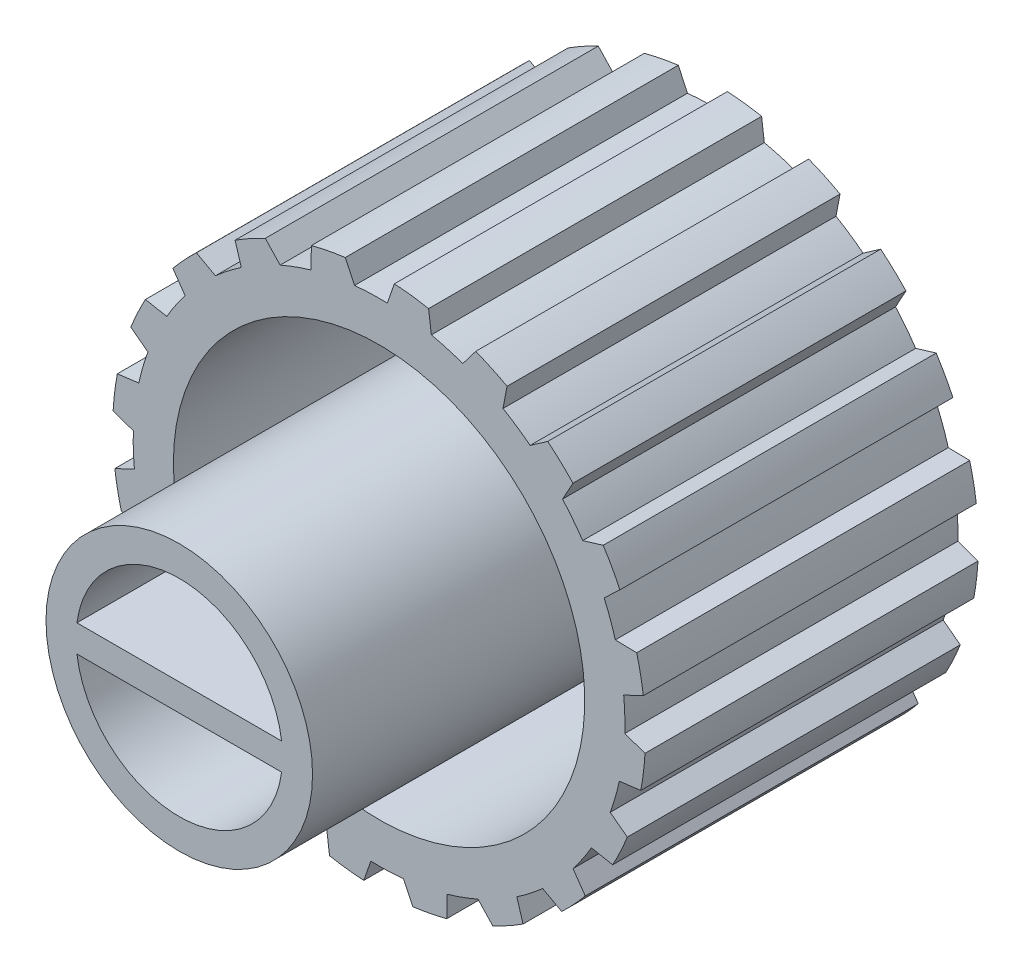
from build123d import *

# Parameters (mm, degrees)
CROQUIS1_R                    = 8
SALIENTE_EXTRUIR1_DEPTH       = 10
CROQUIS2_R                    = 7
CORTAR_EXTRUIR1_DEPTH         = 8
CROQUIS3_R                    = 5
SALIENTE_EXTRUIR2_DEPTH       = 14
CROQUIS4_R                    = 3.5
CORTAR_EXTRUIR2_DEPTH         = 14
CROQUIS5_W                    = 8.830556774
CROQUIS5_H                    = 0.810001326
SALIENTE_EXTRUIR3_DEPTH       = 14
SALIENTE_EXTRUIR4_START       = -10
SALIENTE_EXTRUIR4_OUTLINE_R   = 7
SALIENTE_EXTRUIR4_OUTLINE_R_2 = 6.177042676
SALIENTE_EXTRUIR4_DEPTH       = 8
CORTAR_EXTRUIR10_DEPTH        = 10
SALIENTE_EXTRUIR7_START       = -14
CROQUIS12_R                   = 3.5
CROQUIS12_R_2                 = 3.1
SALIENTE_EXTRUIR7_DEPTH       = 14
CROQUIS14_R                   = 5.293122991
CROQUIS14_R_2                 = 4.002052416
CORTAR_EXTRUIR15_DEPTH        = 14


# Read off the part's stored shape, not the designer's step: Saliente-Extruir4
with BuildPart() as part:
    # Croquis1 → Saliente-Extruir1 (new body)
    with BuildSketch(Plane.XY):
        Circle(CROQUIS1_R)
    extrude(amount=SALIENTE_EXTRUIR1_DEPTH)

    # Croquis2 → Cortar-Extruir1 (cut)
    with BuildSketch(Plane.XY.offset(10)):
        Circle(CROQUIS2_R)
    extrude(amount=-CORTAR_EXTRUIR1_DEPTH, mode=Mode.SUBTRACT)

    # Croquis3 → Saliente-Extruir2 (add)
    with BuildSketch(Plane.XY.offset(2)):
        Circle(CROQUIS3_R)
    extrude(amount=SALIENTE_EXTRUIR2_DEPTH)

    # Croquis4 → Cortar-Extruir2 (cut)
    with BuildSketch(Plane.XY.offset(16)):
        Circle(CROQUIS4_R)
    extrude(amount=-CORTAR_EXTRUIR2_DEPTH, mode=Mode.SUBTRACT)

    # Croquis5 → Saliente-Extruir3 (add)
    with BuildSketch(Plane.XY.offset(2)):
        Rectangle(CROQUIS5_W, CROQUIS5_H)
    extrude(amount=SALIENTE_EXTRUIR3_DEPTH)

    # Saliente-Extruir4 outline → Saliente-Extruir4 (add)
    with BuildSketch(Plane(origin=(0, 0, 0), x_dir=(-1, 0, 0), z_dir=(0, 0, -1)).offset(SALIENTE_EXTRUIR4_START)):
        Circle(SALIENTE_EXTRUIR4_OUTLINE_R)
        Circle(SALIENTE_EXTRUIR4_OUTLINE_R_2, mode=Mode.SUBTRACT)
    extrude(amount=SALIENTE_EXTRUIR4_DEPTH)

    # Croquis11 → Cortar-Extruir10 (cut)
    with BuildSketch(Plane(origin=(0, 0, 0), x_dir=(-1, 0, 0), z_dir=(0, 0, -1))):
        with BuildLine():
            Line((-0.247260298, 7.379594776), (-0.5002941, 8.108053777))
            Line((-0.5002941, 8.108053777), (1.061510951, 8.036738478))
            Line((1.061510951, 8.036738478), (0.736778233, 7.346884683))
            ThreePointArc((0.736778233, 7.346884683), (0.245304789, 7.379660038), (-0.247260298, 7.379594776))
        make_face()
        with BuildLine():
            Line((2.029718445, 7.865816758), (3.493045676, 7.315367575))
            Line((3.493045676, 7.315367575), (2.971029962, 6.759625557))
            ThreePointArc((2.971029962, 6.759625557), (2.513739083, 6.942670418), (2.045261679, 7.094819334))
            Line((2.045261679, 7.094819334), (2.029718445, 7.865816758))
        make_face()
        with BuildLine():
            Line((4.137579194, 6.115553542), (4.361048006, 6.853618791))
            Line((4.361048006, 6.853618791), (5.582656753, 5.877917526))
            Line((5.582656753, 5.877917526), (4.914456579, 5.510687185))
            ThreePointArc((4.914456579, 5.510687185), (4.536111081, 5.826083846), (4.137579194, 6.115553542))
        make_face()
        with BuildLine():
            Line((5.824881629, 4.537654761), (6.265487803, 5.170540864))
            Line((6.265487803, 5.170540864), (7.12579849, 3.865095955))
            Line((7.12579849, 3.865095955), (6.376821944, 3.722324356))
            ThreePointArc((6.376821944, 3.722324356), (6.114456921, 4.139199594), (5.824881629, 4.537654761))
        make_face()
        with BuildLine():
            Line((6.942004065, 2.515578715), (7.556618, 2.981334372))
            Line((7.556618, 2.981334372), (7.971417423, 1.473931862))
            Line((7.971417423, 1.473931862), (7.214979548, 1.569594483))
            ThreePointArc((7.214979548, 1.569594483), (7.094277116, 2.047141646), (6.942004065, 2.515578715))
        make_face()
        with BuildLine():
            Line((7.379594776, 0.247260298), (8.108053777, 0.5002941))
            Line((8.108053777, 0.5002941), (8.036738478, -1.061510951))
            Line((8.036738478, -1.061510951), (7.346884683, -0.736778233))
            ThreePointArc((7.346884683, -0.736778233), (7.379660038, -0.245304789), (7.379594776, 0.247260298))
        make_face()
        with BuildLine():
            Line((7.094819334, -2.045261679), (7.865816758, -2.029718445))
            Line((7.865816758, -2.029718445), (7.315367575, -3.493045676))
            Line((7.315367575, -3.493045676), (6.759625557, -2.971029962))
            ThreePointArc((6.759625557, -2.971029962), (6.942670418, -2.513739083), (7.094819334, -2.045261679))
        make_face()
        with BuildLine():
            Line((6.115553542, -4.137579194), (6.853618791, -4.361048006))
            Line((6.853618791, -4.361048006), (5.877917526, -5.582656753))
            Line((5.877917526, -5.582656753), (5.510687185, -4.914456579))
            ThreePointArc((5.510687185, -4.914456579), (5.826083846, -4.536111081), (6.115553542, -4.137579194))
        make_face()
        with BuildLine():
            Line((4.537654761, -5.824881629), (5.170540864, -6.265487803))
            Line((5.170540864, -6.265487803), (3.865095955, -7.12579849))
            Line((3.865095955, -7.12579849), (3.722324356, -6.376821944))
            ThreePointArc((3.722324356, -6.376821944), (4.139199594, -6.114456921), (4.537654761, -5.824881629))
        make_face()
        with BuildLine():
            Line((2.515578715, -6.942004065), (2.981334372, -7.556618))
            Line((2.981334372, -7.556618), (1.473931862, -7.971417423))
            Line((1.473931862, -7.971417423), (1.569594483, -7.214979548))
            ThreePointArc((1.569594483, -7.214979548), (2.047141646, -7.094277116), (2.515578715, -6.942004065))
        make_face()
        with BuildLine():
            Line((0.247260298, -7.379594776), (0.5002941, -8.108053777))
            Line((0.5002941, -8.108053777), (-1.061510951, -8.036738478))
            Line((-1.061510951, -8.036738478), (-0.736778233, -7.346884683))
            ThreePointArc((-0.736778233, -7.346884683), (-0.245304789, -7.379660038), (0.247260298, -7.379594776))
        make_face()
        with BuildLine():
            Line((-2.045261679, -7.094819334), (-2.029718445, -7.865816758))
            Line((-2.029718445, -7.865816758), (-3.493045676, -7.315367575))
            Line((-3.493045676, -7.315367575), (-2.971029962, -6.759625557))
            ThreePointArc((-2.971029962, -6.759625557), (-2.513739083, -6.942670418), (-2.045261679, -7.094819334))
        make_face()
        with BuildLine():
            Line((-4.137579194, -6.115553542), (-4.361048006, -6.853618791))
            Line((-4.361048006, -6.853618791), (-5.582656753, -5.877917526))
            Line((-5.582656753, -5.877917526), (-4.914456579, -5.510687185))
            ThreePointArc((-4.914456579, -5.510687185), (-4.536111081, -5.826083846), (-4.137579194, -6.115553542))
        make_face()
        with BuildLine():
            Line((-5.824881629, -4.537654761), (-6.265487803, -5.170540864))
            Line((-6.265487803, -5.170540864), (-7.12579849, -3.865095955))
            Line((-7.12579849, -3.865095955), (-6.376821944, -3.722324356))
            ThreePointArc((-6.376821944, -3.722324356), (-6.114456921, -4.139199594), (-5.824881629, -4.537654761))
        make_face()
        with BuildLine():
            Line((-6.942004065, -2.515578715), (-7.556618, -2.981334372))
            Line((-7.556618, -2.981334372), (-7.971417423, -1.473931862))
            Line((-7.971417423, -1.473931862), (-7.214979548, -1.569594483))
            ThreePointArc((-7.214979548, -1.569594483), (-7.094277116, -2.047141646), (-6.942004065, -2.515578715))
        make_face()
        with BuildLine():
            Line((-7.379594776, -0.247260298), (-8.108053777, -0.5002941))
            Line((-8.108053777, -0.5002941), (-8.036738478, 1.061510951))
            Line((-8.036738478, 1.061510951), (-7.346884683, 0.736778233))
            ThreePointArc((-7.346884683, 0.736778233), (-7.379660038, 0.245304789), (-7.379594776, -0.247260298))
        make_face()
        with BuildLine():
            Line((-7.094819334, 2.045261679), (-7.865816758, 2.029718445))
            Line((-7.865816758, 2.029718445), (-7.315367575, 3.493045676))
            Line((-7.315367575, 3.493045676), (-6.759625557, 2.971029962))
            ThreePointArc((-6.759625557, 2.971029962), (-6.942670418, 2.513739083), (-7.094819334, 2.045261679))
        make_face()
        with BuildLine():
            Line((-6.115553542, 4.137579194), (-6.853618791, 4.361048006))
            Line((-6.853618791, 4.361048006), (-5.877917526, 5.582656753))
            Line((-5.877917526, 5.582656753), (-5.510687185, 4.914456579))
            ThreePointArc((-5.510687185, 4.914456579), (-5.826083846, 4.536111081), (-6.115553542, 4.137579194))
        make_face()
        with BuildLine():
            Line((-4.537654761, 5.824881629), (-5.170540864, 6.265487803))
            Line((-5.170540864, 6.265487803), (-3.865095955, 7.12579849))
            Line((-3.865095955, 7.12579849), (-3.722324356, 6.376821944))
            ThreePointArc((-3.722324356, 6.376821944), (-4.139199594, 6.114456921), (-4.537654761, 5.824881629))
        make_face()
        with BuildLine():
            Line((-2.515578715, 6.942004065), (-2.981334372, 7.556618))
            Line((-2.981334372, 7.556618), (-1.473931862, 7.971417423))
            Line((-1.473931862, 7.971417423), (-1.569594483, 7.214979548))
            ThreePointArc((-1.569594483, 7.214979548), (-2.047141646, 7.094277116), (-2.515578715, 6.942004065))
        make_face()
    extrude(amount=-CORTAR_EXTRUIR10_DEPTH, mode=Mode.SUBTRACT)

    # Croquis12 → Saliente-Extruir7 (add)
    with BuildSketch(Plane.XY.offset(16).offset(SALIENTE_EXTRUIR7_START)):
        Circle(CROQUIS12_R)
        Circle(CROQUIS12_R_2, mode=Mode.SUBTRACT)
    extrude(amount=SALIENTE_EXTRUIR7_DEPTH)

    # Croquis14 → Cortar-Extruir15 (cut)
    with BuildSketch(Plane.XY.offset(16)):
        Circle(CROQUIS14_R)
        Circle(CROQUIS14_R_2, mode=Mode.SUBTRACT)
    extrude(amount=-CORTAR_EXTRUIR15_DEPTH, mode=Mode.SUBTRACT)


solid = part.part
